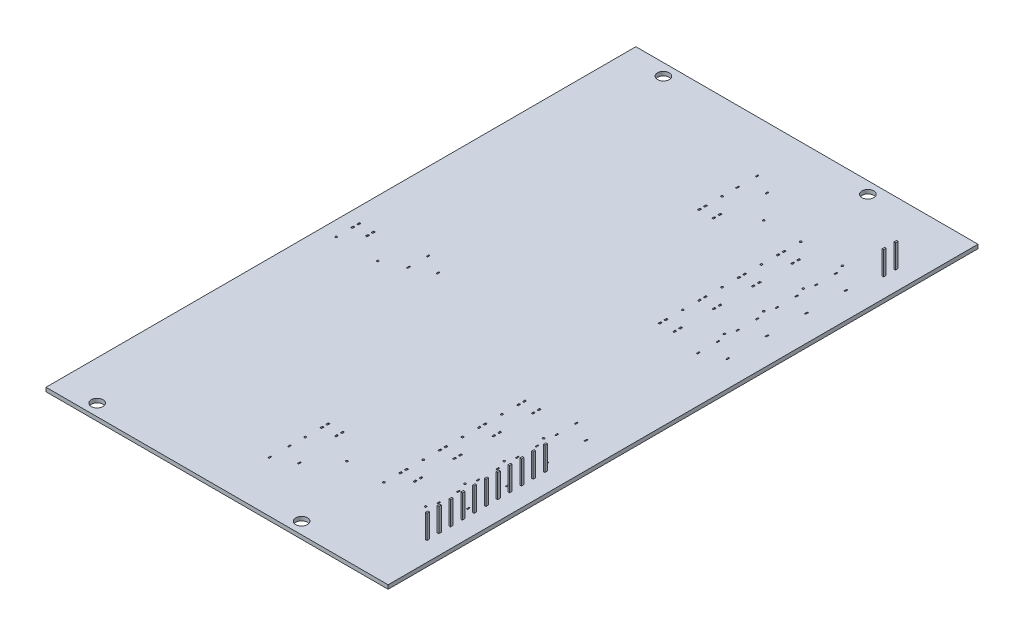
from build123d import *

# Parameters (mm, degrees)
BOSS_EXTRUDE1_DEPTH = 1
SKETCH3_R           = 0.25
SKETCH3_W           = 0.4
SKETCH3_H           = 0.65
SKETCH3_W_2         = 0.3
SKETCH3_H_2         = 0.7
CUT_EXTRUDE1_DEPTH  = 1
SKETCH6_R           = 0.25
SKETCH6_W           = 0.4
SKETCH6_H           = 0.65
SKETCH6_W_2         = 0.3
SKETCH6_H_2         = 0.7
CUT_EXTRUDE3_DEPTH  = 1
SKETCH7_R           = 1.5
CUT_EXTRUDE4_DEPTH  = 1
SKETCH9_W           = 0.4
SKETCH9_H           = 0.65
BOSS_EXTRUDE2_DEPTH = 7


with BuildPart() as part:
    # Sketch1 → Boss-Extrude1 (new body)
    with BuildSketch(Plane(origin=(0, 0, 0), x_dir=(1, 0, 0), z_dir=(0, 1, 0))):
        Polygon((-25, -75), (25, -75), (25, 75), (-25, 75), (-62, 75), (-62, -75), align=None)
    extrude(amount=BOSS_EXTRUDE1_DEPTH)

    # Sketch3 → Cut-Extrude1 (cut)
    with BuildSketch(Plane.XZ):
        with Locations((1.925434, -23)):
            Circle(SKETCH3_R)
        with Locations((12.525434, -23)):
            Circle(SKETCH3_R)
        with Locations((1.925434, 33)):
            Circle(SKETCH3_R)
        with Locations((12.525434, 33)):
            Circle(SKETCH3_R)
        with Locations((1.925434, -33)):
            Circle(SKETCH3_R)
        with Locations((12.525434, -33)):
            Circle(SKETCH3_R)
        with Locations((1.925434, 23)):
            Circle(SKETCH3_R)
        with Locations((12.525434, 23)):
            Circle(SKETCH3_R)
        with Locations((1.925434, 43)):
            Circle(SKETCH3_R)
        with Locations((12.525434, 43)):
            Circle(SKETCH3_R)
        with Locations((1.925434, -43)):
            Circle(SKETCH3_R)
        with Locations((12.525434, -43)):
            Circle(SKETCH3_R)
        with Locations((-18.074566, -53)):
            Circle(SKETCH3_R)
        with Locations((-7.474566, -53)):
            Circle(SKETCH3_R)
        with Locations((1.925434, 53)):
            Circle(SKETCH3_R)
        with Locations((12.525434, 53)):
            Circle(SKETCH3_R)
        with Locations((-18.074566, 53)):
            Circle(SKETCH3_R)
        with Locations((-7.474566, 53)):
            Circle(SKETCH3_R)
        with Locations((1.925434, -53)):
            Circle(SKETCH3_R)
        with Locations((12.525434, -53)):
            Circle(SKETCH3_R)
        with Locations((1.925434, -17.25)):
            Rectangle(SKETCH3_W, SKETCH3_H)
        with Locations((5.625434, -17.25)):
            Rectangle(SKETCH3_W, SKETCH3_H)
        with Locations((5.625434, -18.75)):
            Rectangle(SKETCH3_W, SKETCH3_H)
        with Locations((1.925434, -18.75)):
            Rectangle(SKETCH3_W, SKETCH3_H)
        with Locations((5.625434, 17.25)):
            Rectangle(SKETCH3_W, SKETCH3_H)
        with Locations((1.925434, 17.25)):
            Rectangle(SKETCH3_W, SKETCH3_H)
        with Locations((5.625434, 18.75)):
            Rectangle(SKETCH3_W, SKETCH3_H)
        with Locations((1.925434, 18.75)):
            Rectangle(SKETCH3_W, SKETCH3_H)
        with Locations((1.925434, 28.75)):
            Rectangle(SKETCH3_W, SKETCH3_H)
        with Locations((1.925434, 27.25)):
            Rectangle(SKETCH3_W, SKETCH3_H)
        with Locations((5.625434, 27.25)):
            Rectangle(SKETCH3_W, SKETCH3_H)
        with Locations((5.625434, 28.75)):
            Rectangle(SKETCH3_W, SKETCH3_H)
        with Locations((1.925434, 38.75)):
            Rectangle(SKETCH3_W, SKETCH3_H)
        with Locations((1.925434, 37.25)):
            Rectangle(SKETCH3_W, SKETCH3_H)
        with Locations((5.625434, 37.25)):
            Rectangle(SKETCH3_W, SKETCH3_H)
        with Locations((5.625434, 38.75)):
            Rectangle(SKETCH3_W, SKETCH3_H)
        with Locations((1.925434, 48.75)):
            Rectangle(SKETCH3_W, SKETCH3_H)
        with Locations((1.925434, 47.25)):
            Rectangle(SKETCH3_W, SKETCH3_H)
        with Locations((5.625434, 47.25)):
            Rectangle(SKETCH3_W, SKETCH3_H)
        with Locations((5.625434, 48.75)):
            Rectangle(SKETCH3_W, SKETCH3_H)
        with Locations((1.925434, -27.25)):
            Rectangle(SKETCH3_W, SKETCH3_H)
        with Locations((1.925434, -28.75)):
            Rectangle(SKETCH3_W, SKETCH3_H)
        with Locations((5.625434, -27.25)):
            Rectangle(SKETCH3_W, SKETCH3_H)
        with Locations((5.625434, -28.75)):
            Rectangle(SKETCH3_W, SKETCH3_H)
        with Locations((1.925434, -37.25)):
            Rectangle(SKETCH3_W, SKETCH3_H)
        with Locations((1.925434, -38.75)):
            Rectangle(SKETCH3_W, SKETCH3_H)
        with Locations((5.625434, -37.25)):
            Rectangle(SKETCH3_W, SKETCH3_H)
        with Locations((5.625434, -38.75)):
            Rectangle(SKETCH3_W, SKETCH3_H)
        with Locations((1.925434, -47.25)):
            Rectangle(SKETCH3_W, SKETCH3_H)
        with Locations((1.925434, -48.75)):
            Rectangle(SKETCH3_W, SKETCH3_H)
        with Locations((5.625434, -47.25)):
            Rectangle(SKETCH3_W, SKETCH3_H)
        with Locations((5.625434, -48.75)):
            Rectangle(SKETCH3_W, SKETCH3_H)
        with Locations((13.367157, 30.5)):
            Rectangle(SKETCH3_W_2, SKETCH3_H_2)
        with Locations((18.367157, 18)):
            Rectangle(SKETCH3_W_2, SKETCH3_H_2)
        with Locations((-18.074566, 47.25)):
            Rectangle(SKETCH3_W, SKETCH3_H)
        with Locations((-18.074566, 48.75)):
            Rectangle(SKETCH3_W, SKETCH3_H)
        with Locations((-14.374566, 47.25)):
            Rectangle(SKETCH3_W, SKETCH3_H)
        with Locations((-14.374566, 48.75)):
            Rectangle(SKETCH3_W, SKETCH3_H)
        with Locations((-18.074566, -48.75)):
            Rectangle(SKETCH3_W, SKETCH3_H)
        with Locations((-18.074566, -47.25)):
            Rectangle(SKETCH3_W, SKETCH3_H)
        with Locations((-14.374566, -47.25)):
            Rectangle(SKETCH3_W, SKETCH3_H)
        with Locations((-14.374566, -48.75)):
            Rectangle(SKETCH3_W, SKETCH3_H)
        with Locations((13.367157, 15.5)):
            Rectangle(SKETCH3_W_2, SKETCH3_H_2)
        with Locations((13.367157, 20.5)):
            Rectangle(SKETCH3_W_2, SKETCH3_H_2)
        with Locations((18.367157, 28)):
            Rectangle(SKETCH3_W_2, SKETCH3_H_2)
        with Locations((13.367157, 25.5)):
            Rectangle(SKETCH3_W_2, SKETCH3_H_2)
        with Locations((13.367157, 40.5)):
            Rectangle(SKETCH3_W_2, SKETCH3_H_2)
        with Locations((18.367157, 38)):
            Rectangle(SKETCH3_W_2, SKETCH3_H_2)
        with Locations((13.367157, 35.5)):
            Rectangle(SKETCH3_W_2, SKETCH3_H_2)
        with Locations((13.367157, 50.5)):
            Rectangle(SKETCH3_W_2, SKETCH3_H_2)
        with Locations((18.367157, 48)):
            Rectangle(SKETCH3_W_2, SKETCH3_H_2)
        with Locations((13.367157, 45.5)):
            Rectangle(SKETCH3_W_2, SKETCH3_H_2)
        with Locations((18.367157, -18)):
            Rectangle(SKETCH3_W_2, SKETCH3_H_2)
        with Locations((13.367157, -15.5)):
            Rectangle(SKETCH3_W_2, SKETCH3_H_2)
        with Locations((13.367157, -20.5)):
            Rectangle(SKETCH3_W_2, SKETCH3_H_2)
        with Locations((13.367157, -25.5)):
            Rectangle(SKETCH3_W_2, SKETCH3_H_2)
        with Locations((13.367157, -30.5)):
            Rectangle(SKETCH3_W_2, SKETCH3_H_2)
        with Locations((18.367157, -28)):
            Rectangle(SKETCH3_W_2, SKETCH3_H_2)
        with Locations((13.367157, -35.5)):
            Rectangle(SKETCH3_W_2, SKETCH3_H_2)
        with Locations((13.367157, -40.5)):
            Rectangle(SKETCH3_W_2, SKETCH3_H_2)
        with Locations((18.367157, -38)):
            Rectangle(SKETCH3_W_2, SKETCH3_H_2)
        with Locations((13.367157, -45.5)):
            Rectangle(SKETCH3_W_2, SKETCH3_H_2)
        with Locations((13.367157, -50.5)):
            Rectangle(SKETCH3_W_2, SKETCH3_H_2)
        with Locations((18.367157, -48)):
            Rectangle(SKETCH3_W_2, SKETCH3_H_2)
        with Locations((-18.112545796, 61.957674801)):
            Rectangle(SKETCH3_W_2, SKETCH3_H_2)
        with Locations((-18.112545796, 56.957674801)):
            Rectangle(SKETCH3_W_2, SKETCH3_H_2)
        with Locations((-13.112545796, 59.457674801)):
            Rectangle(SKETCH3_W_2, SKETCH3_H_2)
        with Locations((-18.112545796, -56.957674801)):
            Rectangle(SKETCH3_W_2, SKETCH3_H_2)
        with Locations((-18.112545796, -61.957674801)):
            Rectangle(SKETCH3_W_2, SKETCH3_H_2)
        with Locations((-13.112545796, -59.457674801)):
            Rectangle(SKETCH3_W_2, SKETCH3_H_2)
    extrude(amount=-CUT_EXTRUDE1_DEPTH, mode=Mode.SUBTRACT)

    # Sketch6 → Cut-Extrude3 (cut)
    with BuildSketch(Plane(origin=(0, 1, 0), x_dir=(1, 0, 0), z_dir=(0, 1, 0))):
        with Locations((-58.213528352, -5)):
            Circle(SKETCH6_R)
        with Locations((-47.613528352, -5)):
            Circle(SKETCH6_R)
        with Locations((-54.524566, -0.75)):
            Rectangle(SKETCH6_W, SKETCH6_H)
        with Locations((-58.224566, 0.75)):
            Rectangle(SKETCH6_W, SKETCH6_H)
        with Locations((-54.524566, 0.75)):
            Rectangle(SKETCH6_W, SKETCH6_H)
        with Locations((-58.224566, -0.75)):
            Rectangle(SKETCH6_W, SKETCH6_H)
        with Locations((-37.328308873, 0)):
            Rectangle(SKETCH6_W_2, SKETCH6_H_2)
        with Locations((-42.328308873, -2.5)):
            Rectangle(SKETCH6_W_2, SKETCH6_H_2)
        with Locations((-42.328308873, 2.5)):
            Rectangle(SKETCH6_W_2, SKETCH6_H_2)
    extrude(amount=-CUT_EXTRUDE3_DEPTH, mode=Mode.SUBTRACT)

    # Sketch7 → Cut-Extrude4 (cut)
    with BuildSketch(Plane(origin=(0, 1, 0), x_dir=(1, 0, 0), z_dir=(0, 1, 0))):
        with Locations((0, 72)):
            Circle(SKETCH7_R)
        with Locations((0, -72)):
            Circle(SKETCH7_R)
        with Locations((-52, 72)):
            Circle(SKETCH7_R)
        with Locations((-52, -72)):
            Circle(SKETCH7_R)
    extrude(amount=-CUT_EXTRUDE4_DEPTH, mode=Mode.SUBTRACT)

    # Sketch9 → Boss-Extrude2 (add)
    with BuildSketch(Plane.XZ):
        with Locations((20, 57)):
            Rectangle(SKETCH9_W, SKETCH9_H)
        with Locations((20, 60)):
            Rectangle(SKETCH9_W, SKETCH9_H)
        with Locations((20, 54)):
            Rectangle(SKETCH9_W, SKETCH9_H)
        with Locations((20, 51)):
            Rectangle(SKETCH9_W, SKETCH9_H)
        with Locations((20, 48)):
            Rectangle(SKETCH9_W, SKETCH9_H)
        with Locations((20, 45)):
            Rectangle(SKETCH9_W, SKETCH9_H)
        with Locations((20, 42)):
            Rectangle(SKETCH9_W, SKETCH9_H)
        with Locations((20, 39)):
            Rectangle(SKETCH9_W, SKETCH9_H)
        with Locations((20, 36)):
            Rectangle(SKETCH9_W, SKETCH9_H)
        with Locations((20, 33)):
            Rectangle(SKETCH9_W, SKETCH9_H)
        with Locations((20, 30)):
            Rectangle(SKETCH9_W, SKETCH9_H)
        with Locations((20, -56.127886336)):
            Rectangle(SKETCH9_W, SKETCH9_H)
        with Locations((20, -59.127886336)):
            Rectangle(SKETCH9_W, SKETCH9_H)
    extrude(amount=-BOSS_EXTRUDE2_DEPTH)


solid = part.part
